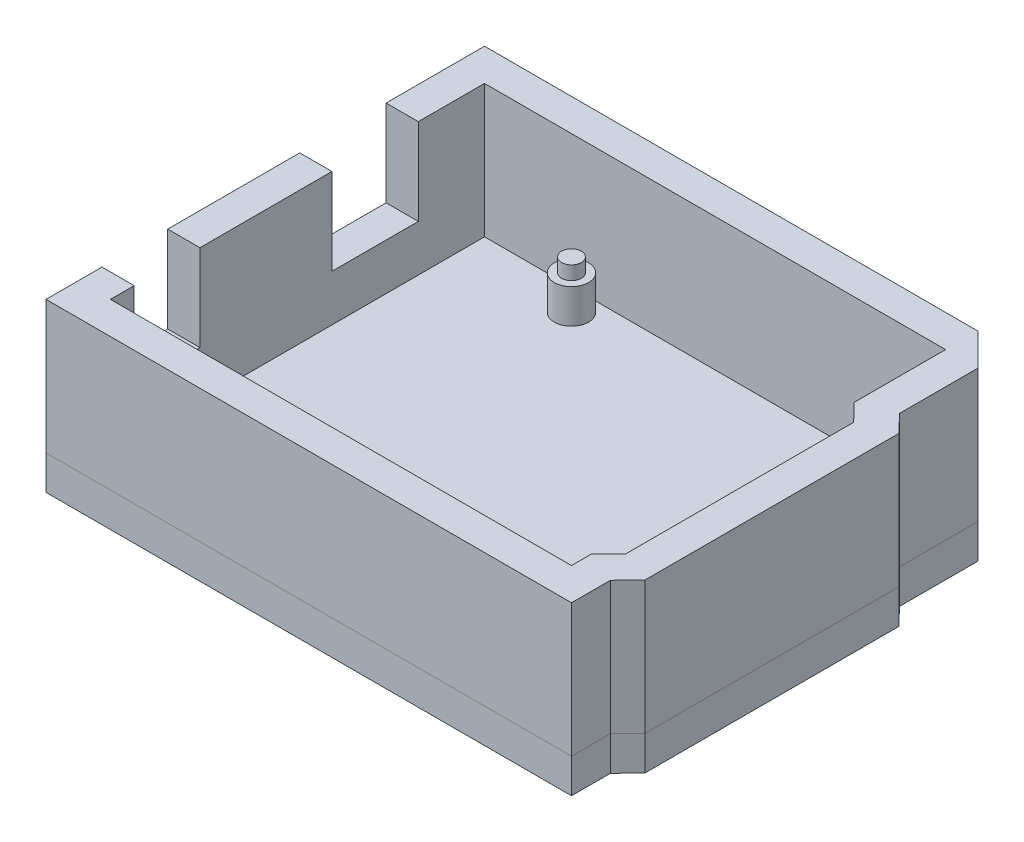
from build123d import *

# Parameters (mm, degrees)
SKETCH2_R           = 1.5875
BOSS_EXTRUDE1_DEPTH = 5
BOSS_EXTRUDE3_DEPTH = 10
SKETCH5_W           = 4.7
SKETCH5_H           = 12.6
SKETCH5_H_2         = 9.589693512
CUT_EXTRUDE1_DEPTH  = 3.22
SKETCH8_W           = 4.7
SKETCH8_H           = 19.26
BOSS_EXTRUDE4_DEPTH = 9.39
SKETCH9_R           = 2.5
BOSS_EXTRUDE5_DEPTH = 5
SKETCH10_R          = 1.44
SKETCH10_R_2        = 1.425
BOSS_EXTRUDE6_DEPTH = 2
SKETCH11_W          = 4.7
SKETCH11_H          = 9.589693512
CUT_EXTRUDE2_DEPTH  = 0.01


with BuildPart() as part:
    # Sketch2 → Boss-Extrude1 (new body)
    with BuildSketch(Plane(origin=(0, 0, 0), x_dir=(1, 0, 0), z_dir=(0, 1, 0))):
        Polygon((13.220192639, 43.095561972), (-58.780349242, 43.095561972), (-58.780349242, -20.882908028), (17.889650758, -20.882908028), (17.889650758, -15.201225268), (20.369650758, -12.661225268), (20.369650758, 24.421409213), (17.889650758, 26.961409213), (17.889650758, 38.426103853), align=None)
        with Locations((-39.510349242, -13.042908028)):
            Circle(SKETCH2_R, mode=Mode.SUBTRACT)
        with Locations((12.589650758, -7.962908028)):
            Circle(SKETCH2_R, mode=Mode.SUBTRACT)
        with Locations((-38.210349242, 35.217091972)):
            Circle(SKETCH2_R, mode=Mode.SUBTRACT)
        with Locations((12.557854383, 19.965306842)):
            Circle(SKETCH2_R, mode=Mode.SUBTRACT)
    extrude(amount=BOSS_EXTRUDE1_DEPTH)

    # Sketch4 → Boss-Extrude3 (add)
    with BuildSketch(Plane(origin=(0, 5, 0), x_dir=(1, 0, 0), z_dir=(0, 1, 0))):
        Polygon((-58.781454962, 43.099007319), (13.219086919, 43.099007319), (17.888545038, 38.4295492), (17.888545038, 26.96485456), (20.368545038, 24.42485456), (20.368545038, -12.657779921), (17.888545038, -15.197779921), (17.888545038, -20.879462681), (-58.781454962, -20.879462681), align=None)
        Polygon((13.188545038, 25.05087512), (15.668545038, 22.51087512), (15.668545038, -10.743800481), (13.188545038, -13.283800481), (13.188545038, -16.179462681), (-54.081454962, -16.179462681), (-54.081454962, 38.399007319), (13.188545038, 38.399007319), align=None, mode=Mode.SUBTRACT)
    extrude(amount=BOSS_EXTRUDE3_DEPTH)

    # Sketch5 → Cut-Extrude1 (cut)
    with BuildSketch(Plane(origin=(0, 15, 0), x_dir=(1, 0, 0), z_dir=(0, 1, 0))):
        with Locations((-56.431454962, 22.439007319)):
            Rectangle(SKETCH5_W, SKETCH5_H)
        with Locations((-56.431454962, -7.915839437)):
            Rectangle(SKETCH5_W, SKETCH5_H_2)
    extrude(amount=-CUT_EXTRUDE1_DEPTH, mode=Mode.SUBTRACT)

    # Sketch8 → Boss-Extrude4 (add)
    with BuildSketch(Plane(origin=(0, 15, 0), x_dir=(1, 0, 0), z_dir=(0, 1, 0))):
        Polygon((-54.081454962, -16.179462681), (-54.081454962, -12.710686193), (-58.781454962, -12.710686193), (-58.781454962, -20.879462681), (17.888545038, -20.879462681), (17.888545038, -15.197779921), (20.368545038, -12.657779921), (20.368545038, 24.42485456), (17.888545038, 26.96485456), (17.888545038, 38.4295492), (13.219086919, 43.099007319), (-58.781454962, 43.099007319), (-58.781454962, 28.739007319), (-54.081454962, 28.739007319), (-54.081454962, 38.399007319), (13.188545038, 38.399007319), (13.188545038, 25.05087512), (15.668545038, 22.51087512), (15.668545038, -10.743800481), (13.188545038, -13.283800481), (13.188545038, -16.179462681), align=None)
        with Locations((-56.431454962, 6.509007319)):
            Rectangle(SKETCH8_W, SKETCH8_H)
    extrude(amount=BOSS_EXTRUDE4_DEPTH)

    # Sketch9 → Boss-Extrude5 (add)
    with BuildSketch(Plane(origin=(0, 5, 0), x_dir=(1, 0, 0), z_dir=(0, 1, 0))):
        with Locations((-38.210349242, 35.217091972)):
            Circle(SKETCH9_R)
        with Locations((12.557854383, 19.965306842)):
            Circle(SKETCH9_R)
        with Locations((12.589650758, -7.962908028)):
            Circle(SKETCH9_R)
        with Locations((-39.510349242, -13.042908028)):
            Circle(SKETCH9_R)
    extrude(amount=BOSS_EXTRUDE5_DEPTH)

    # Sketch10 → Boss-Extrude6 (add)
    with BuildSketch(Plane(origin=(0, 10, 0), x_dir=(1, 0, 0), z_dir=(0, 1, 0))):
        with Locations((-38.210349242, 35.217091972)):
            Circle(SKETCH10_R)
        with Locations((12.557854383, 19.965306842)):
            Circle(SKETCH10_R_2)
        with Locations((12.589650758, -7.962908028)):
            Circle(SKETCH10_R_2)
        with Locations((-39.510349242, -13.042908028)):
            Circle(SKETCH10_R_2)
    extrude(amount=BOSS_EXTRUDE6_DEPTH)

    # Sketch11 → Cut-Extrude2 (cut)
    with BuildSketch(Plane(origin=(0, 11.78, 0), x_dir=(1, 0, 0), z_dir=(0, 1, 0))):
        with Locations((-56.431454962, -7.915839437)):
            Rectangle(SKETCH11_W, SKETCH11_H)
    extrude(amount=-CUT_EXTRUDE2_DEPTH, mode=Mode.SUBTRACT)


solid = part.part
